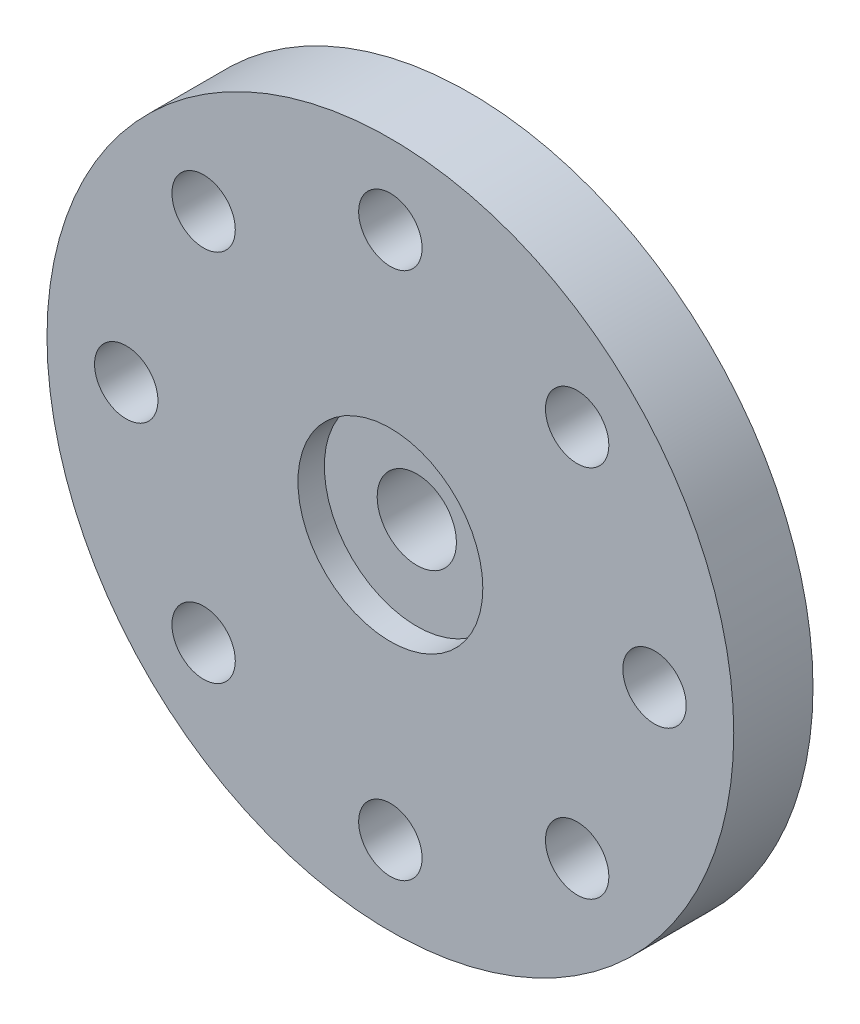
from build123d import *

# Parameters (mm, degrees)
SKETCH2_R           = 13
SKETCH2_R_2         = 1.5
BOSS_EXTRUDE1_DEPTH = 3
SKETCH3_R           = 3.5
CUT_EXTRUDE1_DEPTH  = 1
SKETCH5_R           = 1.2
CUT_EXTRUDE2_DEPTH  = 19.62793601
BOSS_EXTRUDE2_START = 1
SKETCH6_R           = 3
SKETCH6_R_2         = 1.5
BOSS_EXTRUDE2_DEPTH = 1
FILLET1_R           = 0.5


with BuildPart() as part:
    # Sketch2 → Boss-Extrude1 (new body)
    with BuildSketch(Plane.XY):
        Circle(SKETCH2_R)
        Circle(SKETCH2_R_2, mode=Mode.SUBTRACT)
    extrude(amount=BOSS_EXTRUDE1_DEPTH)

    # Sketch3 → Cut-Extrude1 (cut)
    with BuildSketch(Plane.XY.offset(3)):
        Circle(SKETCH3_R)
    extrude(amount=-CUT_EXTRUDE1_DEPTH, mode=Mode.SUBTRACT)

    # Sketch5 → Cut-Extrude2 (cut, through all)
    with BuildSketch(Plane.XY.offset(3)):
        with Locations((-7.071067812, 7.071067812)):
            Circle(SKETCH5_R)
        with Locations((0, 10)):
            Circle(SKETCH5_R)
        with Locations((7.071067812, 7.071067812)):
            Circle(SKETCH5_R)
        with Locations((10, 0)):
            Circle(SKETCH5_R)
        with Locations((7.071067812, -7.071067812)):
            Circle(SKETCH5_R)
        with Locations((0, -10)):
            Circle(SKETCH5_R)
        with Locations((-7.071067812, -7.071067812)):
            Circle(SKETCH5_R)
        with Locations((-10, 0)):
            Circle(SKETCH5_R)
    extrude(amount=-CUT_EXTRUDE2_DEPTH, mode=Mode.SUBTRACT)

    # Sketch6 → Boss-Extrude2 (add)
    with BuildSketch(Plane(origin=(0, 0, 0), x_dir=(-1, 0, 0), z_dir=(0, 0, -1)).offset(BOSS_EXTRUDE2_START)):
        with Locations(Location((0, 0, 0), (0, 0, 180))):
            Circle(SKETCH6_R)
        Circle(SKETCH6_R_2, mode=Mode.SUBTRACT)
    extrude(amount=-BOSS_EXTRUDE2_DEPTH)

    # Fillet1
    fillet1_edges = [part.edges().sort_by_distance(p)[0] for p in [
        (-3, 0, 0),
        (-3, 0, -1),
    ]]
    fillet(fillet1_edges, radius=FILLET1_R - 0.0001)  # a hair under: the kernel refuses the full size


solid = part.part
